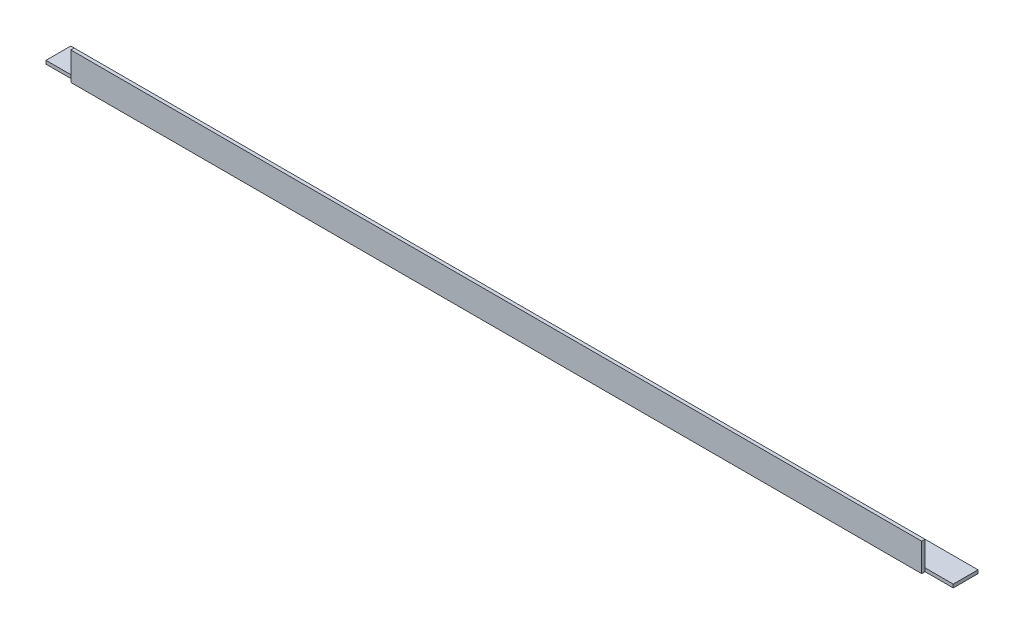
from build123d import *

# Parameters (mm, degrees)
EXTRUDE_1_DEPTH     = 806
SKETCH_2_W          = 25
SKETCH_2_H          = 3
CUT_EXTRUDE_1_DEPTH = 807.775061588


with BuildPart() as part:
    # Эскиз1 → Вытянуть-Тонкостенный1 (new body)
    with BuildSketch(Plane(origin=(0, 0, 0), x_dir=(0, 0, -1), z_dir=(1, 0, 0))):
        Polygon((0, 25), (0, 0), (25, 0), (25, 3), (3, 3), (3, 25), align=None)
    extrude(amount=EXTRUDE_1_DEPTH)

    # Эскиз2 → Вырез-Вытянуть1 (cut, through all)
    with BuildSketch(Plane.XZ):
        with Locations((793.5, -1.5)):
            Rectangle(SKETCH_2_W, SKETCH_2_H)
        with Locations((12.5, -1.5)):
            Rectangle(SKETCH_2_W, SKETCH_2_H)
    extrude(amount=-CUT_EXTRUDE_1_DEPTH, mode=Mode.SUBTRACT)


solid = part.part
